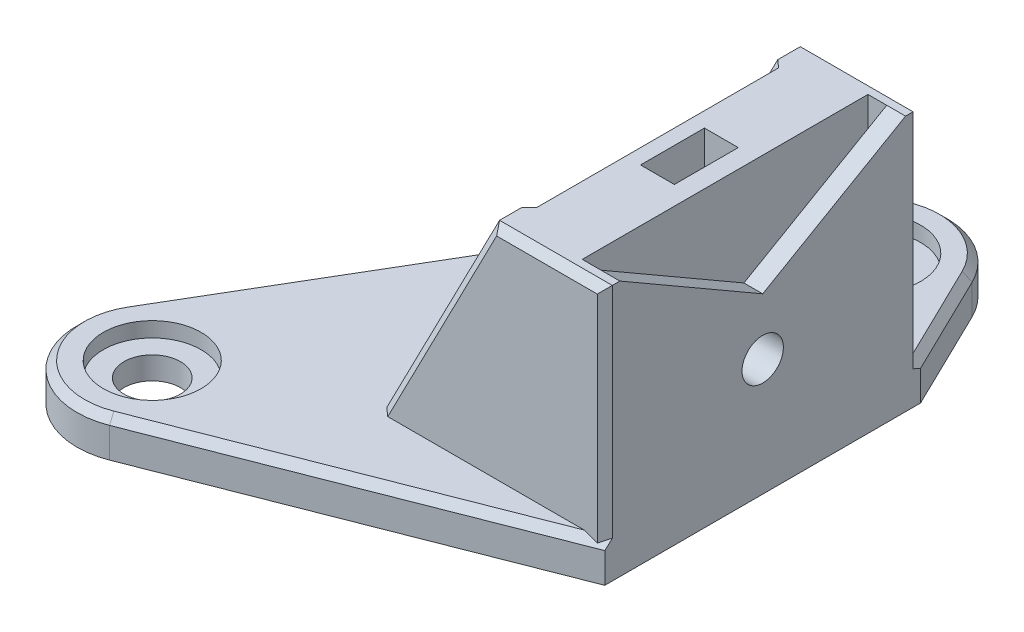
from build123d import *

# Parameters (mm, degrees)
CUT_EXTRUDE1_OUTLINE_W                  = 29.05
CUT_EXTRUDE1_OUTLINE_H                  = 42
CUT_EXTRUDE1_DEPTH                      = 10
CUT_EXTRUDE1_START                      = 10
CUT_EXTRUDE1_2_DEPTH                    = 5
CUT_EXTRUDE1_START_2                    = 12.5
CUT_EXTRUDE1_3_DEPTH                    = 2.5
CUT_EXTRUDE1_4_DEPTH                    = 5
CUT_EXTRUDE1_START_3                    = 37
CUT_EXTRUDE1_5_DEPTH                    = 5
BOSS_EXTRUDE1_DEPTH                     = 5
SKETCH3_W                               = 4.5
SKETCH3_H                               = 8.5
CUT_EXTRUDE2_DEPTH                      = 84.790467835
CBORE_FOR_M5_HEX_HEAD_BOLT1_D           = 5.5
CBORE_FOR_M5_HEX_HEAD_BOLT1_CBORE_D     = 13
CBORE_FOR_M5_HEX_HEAD_BOLT1_CBORE_DEPTH = 2
CBORE_FOR_M6_5_SHSS1_D                  = 7.5
CBORE_FOR_M6_5_SHSS1_CBORE_D            = 13
CBORE_FOR_M6_5_SHSS1_CBORE_DEPTH        = 2
SKETCH8_W                               = 2.75
SKETCH8_H                               = 7.5
F_5_5_5_5_DIAMETER_HOLE2_D              = 5.5
F_5_5_5_5_DIAMETER_HOLE2_DEPTH          = 15
CHAMFER2_SIZE                           = 1
CHAMFER3_SIZE                           = 1
CHAMFER4_SIZE                           = 1


with BuildPart() as part:
    # Cut-Extrude1: read off the stored shape, not the designer's step
    # Cut-Extrude1 outline → Cut-Extrude1 (new body)
    with BuildSketch(Plane.YZ):
        with Locations((14.525, 21)):
            Rectangle(CUT_EXTRUDE1_OUTLINE_W, CUT_EXTRUDE1_OUTLINE_H)
    extrude(amount=CUT_EXTRUDE1_DEPTH)

    # Cut-Extrude1 2 outline → Cut-Extrude1 2 (add)
    with BuildSketch(Plane.YZ.offset(CUT_EXTRUDE1_START)):
        Polygon((29.05, 2), (14.05, 2), (14.05, 40), (29.05, 40), (29.05, 42), (0, 42), (0, 0), (29.05, 0), align=None)
    extrude(amount=CUT_EXTRUDE1_2_DEPTH)

    # Cut-Extrude1 3 outline → Cut-Extrude1 3 (add)
    with BuildSketch(Plane.YZ.offset(CUT_EXTRUDE1_START_2)):
        Polygon((14.05, 2), (29.05, 2), (18.080344885, 21), (29.05, 40), (14.05, 40), align=None)
    extrude(amount=CUT_EXTRUDE1_3_DEPTH)

    # Cut-Extrude1 4 outline → Cut-Extrude1 4 (add)
    with BuildSketch(Plane.XY):
        Polygon((0, 29.05), (-15, 0), (0, 0), align=None)
    extrude(amount=CUT_EXTRUDE1_4_DEPTH)

    # Cut-Extrude1 5 outline → Cut-Extrude1 5 (add)
    with BuildSketch(Plane.XY.offset(CUT_EXTRUDE1_START_3)):
        Polygon((0, 29.05), (-15, 0), (0, 0), align=None)
    extrude(amount=CUT_EXTRUDE1_5_DEPTH)

    # Sketch2 → Boss-Extrude1 (add)
    with BuildSketch(Plane.XZ):
        with BuildLine():
            Line((-9.113819566, -14.079577983), (-44.613819566, 46.120422017))
            ThreePointArc((-44.613819566, 46.120422017), (-43.61404549, 57.68277034), (-32.359107934, 60.513640801))
            Line((-32.359107934, 60.513640801), (15, 42))
            Line((15, 42), (15, 0))
            Line((15, 0), (8.492070756, -13.375232968))
            ThreePointArc((8.492070756, -13.375232968), (-0.100257626, -18.992007107), (-9.113819566, -14.079577983))
        make_face()
    extrude(amount=BOSS_EXTRUDE1_DEPTH)

    # Sketch3 → Cut-Extrude2 (cut, through all)
    with BuildSketch(Plane.XZ.offset(5)):
        with Locations((5.25, 21)):
            Rectangle(SKETCH3_W, SKETCH3_H)
    extrude(amount=-CUT_EXTRUDE2_DEPTH, mode=Mode.SUBTRACT)

    # CBORE for M5 Hex Head Bolt1 (through all)
    with Locations(Plane(origin=(0, 0, 0), x_dir=(1, 0, 0), z_dir=(0, 1, 0))):
        with Locations((-0.5, 9)):
            CounterBoreHole(CBORE_FOR_M5_HEX_HEAD_BOLT1_D / 2, CBORE_FOR_M5_HEX_HEAD_BOLT1_CBORE_D / 2, CBORE_FOR_M5_HEX_HEAD_BOLT1_CBORE_DEPTH)

    # CBORE for M6.5 SHSS1 (through all)
    with Locations(Plane(origin=(0, 0, 0), x_dir=(1, 0, 0), z_dir=(0, 1, 0))):
        with Locations((-36, -51.2)):
            CounterBoreHole(CBORE_FOR_M6_5_SHSS1_D / 2, CBORE_FOR_M6_5_SHSS1_CBORE_D / 2, CBORE_FOR_M6_5_SHSS1_CBORE_DEPTH)

    # Sketch8 → Ø5.5 (5.5) Diameter Hole1 (revolve, cut)
    with BuildSketch(Plane(origin=(7.5, 10.55, 21), x_dir=(0, 0, 1), z_dir=(0, 1, 0))):
        with Locations((1.375, 3.75)):
            Rectangle(SKETCH8_W, SKETCH8_H)
    revolve(axis=Axis((1.15, 10.55, 21), (1, 0, 0)), mode=Mode.SUBTRACT)

    # Ø5.5 (5.5) Diameter Hole2
    with Locations(Plane.ZY):
        with Locations((21, 10.55)):
            Hole(F_5_5_5_5_DIAMETER_HOLE2_D / 2, depth=F_5_5_5_5_DIAMETER_HOLE2_DEPTH)

    # Chamfer2
    chamfer2_edges = [part.edges().sort_by_distance(p)[0] for p in [
        (-7.5, 14.525, 42),
        (7.5, 29.05, 42),
        (-7.5, 14.525, 5),
        (7.5, 29.05, 0),
        (-7.5, 14.525, 0),
        (-7.5, 14.525, 37),
        (-0.100257626, 0, -18.992007107),
        (11.746035378, 0, -6.687616484),
        (-8.679553967, 0, 51.2568204),
        (-43.61404549, 0, 57.68277034),
        (-26.863819566, 0, 16.020422017),
    ]]
    chamfer(chamfer2_edges, length=CHAMFER2_SIZE)

    # Chamfer3
    chamfer3_edges = [part.edges().sort_by_distance(p)[0] for p in [
        (0, 29.05, 21),
    ]]
    chamfer(chamfer3_edges, length=CHAMFER3_SIZE)

    # Chamfer4
    chamfer4_edges = [part.edges().sort_by_distance(p)[0] for p in [
        (15, 13.525, 0),
        (15, 13.525, 42),
    ]]
    chamfer(chamfer4_edges, length=CHAMFER4_SIZE)


solid = part.part
